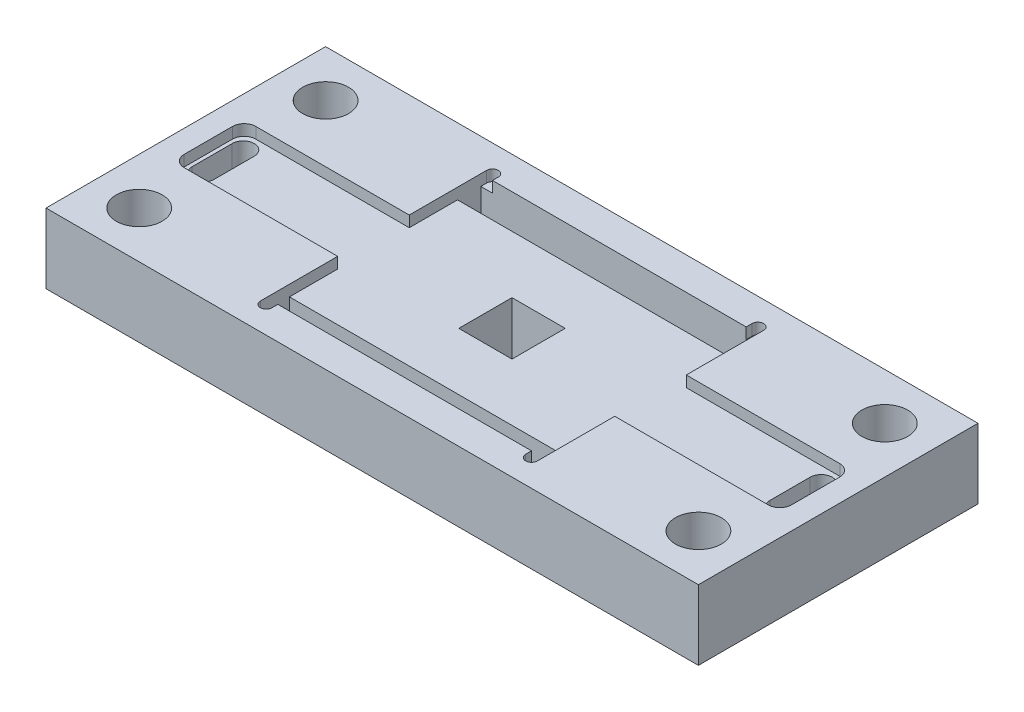
from build123d import *

# Parameters (mm, degrees)
SKETCH1_W           = 177.8
SKETCH1_H           = 76.2
BOSS_EXTRUDE1_DEPTH = 19.05
CUT_EXTRUDE1_DEPTH  = 3
SKETCH3_W           = 14.5
SKETCH3_H           = 14.5
SKETCH3_W_2         = 75.5
SKETCH3_H_2         = 6.35
CUT_EXTRUDE2_DEPTH  = 99.042962522
SKETCH4_R           = 3.5
CUT_EXTRUDE3_DEPTH  = 99.578509321
FILLET1_R           = 3.175
SKETCH5_R           = 6.25
CUT_EXTRUDE4_DEPTH  = 12.7
SKETCH6_W           = 3.175
SKETCH6_H           = 3.18
SKETCH6_W_2         = 3.18
CUT_EXTRUDE5_DEPTH  = 3
FILLET2_R           = 1.5875
FILLET3_R           = 1.59
FILLET4_R           = 1.5875
FILLET5_R           = 1.59
CUT_EXTRUDE6_DEPTH  = 35
CUT_EXTRUDE7_DEPTH  = 35


with BuildPart() as part:
    # Sketch1 → Boss-Extrude1 (new body)
    with BuildSketch(Plane(origin=(0, 0, 0), x_dir=(1, 0, 0), z_dir=(0, 1, 0))):
        Rectangle(SKETCH1_W, SKETCH1_H)
    extrude(amount=-BOSS_EXTRUDE1_DEPTH)

    # Sketch2 → Cut-Extrude1 (cut)
    with BuildSketch(Plane(origin=(0, 0, 0), x_dir=(1, 0, 0), z_dir=(0, 1, 0))):
        Polygon((37.75, 9.75), (82.75, 9.75), (82.75, -9.75), (37.75, -9.75), (37.75, -29.25), (-37.75, -29.25), (-37.75, -9.75), (-82.75, -9.75), (-82.75, 9.75), (-37.75, 9.75), (-37.75, 29.25), (37.75, 29.25), align=None)
    extrude(amount=-CUT_EXTRUDE1_DEPTH, mode=Mode.SUBTRACT)

    # Sketch3 → Cut-Extrude2 (cut, through all)
    with BuildSketch(Plane(origin=(0, -3, 0), x_dir=(1, 0, 0), z_dir=(0, 1, 0))):
        Rectangle(SKETCH3_W, SKETCH3_H)
        with Locations((0, 26.075)):
            Rectangle(SKETCH3_W_2, SKETCH3_H_2)
        with Locations((0, -26.075)):
            Rectangle(SKETCH3_W_2, SKETCH3_H_2)
    extrude(amount=-CUT_EXTRUDE2_DEPTH, mode=Mode.SUBTRACT)

    # Sketch4 → Cut-Extrude3 (cut, through all)
    with BuildSketch(Plane(origin=(0, 0, 0), x_dir=(1, 0, 0), z_dir=(0, 1, 0))):
        with Locations(Location((-76.2, 25.4, 0), (0, 0, 270))):
            Circle(SKETCH4_R)
        with Locations(Location((76.2, 25.4, 0), (0, 0, 270))):
            Circle(SKETCH4_R)
        with Locations(Location((76.2, -25.4, 0), (0, 0, 270))):
            Circle(SKETCH4_R)
        with Locations(Location((-76.2, -25.4, 0), (0, 0, 270))):
            Circle(SKETCH4_R)
    extrude(amount=-CUT_EXTRUDE3_DEPTH, mode=Mode.SUBTRACT)

    # Fillet1
    fillet1_edges = [part.edges().sort_by_distance(p)[0] for p in [
        (82.75, -1.5, -9.75),
        (82.75, -1.5, 9.75),
        (-82.75, -1.5, 9.75),
        (-82.75, -1.5, -9.75),
    ]]
    fillet(fillet1_edges, radius=FILLET1_R)

    # Sketch5 → Cut-Extrude4 (cut)
    with BuildSketch(Plane(origin=(0, 0, 0), x_dir=(1, 0, 0), z_dir=(0, 1, 0))):
        with Locations(Location((-76.2, -25.4, 0), (0, 0, 270))):
            Circle(SKETCH5_R)
        with Locations(Location((-76.2, 25.4, 0), (0, 0, 270))):
            Circle(SKETCH5_R)
        with Locations(Location((76.2, 25.4, 0), (0, 0, 270))):
            Circle(SKETCH5_R)
        with Locations(Location((76.2, -25.4, 0), (0, 0, 270))):
            Circle(SKETCH5_R)
    extrude(amount=-CUT_EXTRUDE4_DEPTH, mode=Mode.SUBTRACT)

    # Sketch6 → Cut-Extrude5 (cut)
    with BuildSketch(Plane(origin=(0, 0, 0), x_dir=(1, 0, 0), z_dir=(0, 1, 0))):
        with Locations((-36.1625, 30.84)):
            Rectangle(SKETCH6_W, SKETCH6_H)
        with Locations((36.16, 30.84)):
            Rectangle(SKETCH6_W_2, SKETCH6_H)
        with Locations((36.16, -30.84)):
            Rectangle(SKETCH6_W_2, SKETCH6_H)
        with Locations((-36.1625, -30.84)):
            Rectangle(SKETCH6_W, SKETCH6_H)
    extrude(amount=-CUT_EXTRUDE5_DEPTH, mode=Mode.SUBTRACT)

    # Fillet2
    fillet2_edges = [part.edges().sort_by_distance(p)[0] for p in [
        (-37.75, -1.5, -32.43),
        (-34.575, -1.5, -32.43),
    ]]
    fillet(fillet2_edges, radius=FILLET2_R - 0.0001)  # a hair under: the kernel refuses the full size

    # Fillet3
    fillet3_edges = [part.edges().sort_by_distance(p)[0] for p in [
        (37.75, -1.5, -32.43),
        (34.57, -1.5, -32.43),
    ]]
    fillet(fillet3_edges, radius=FILLET3_R - 0.0001)  # a hair under: the kernel refuses the full size

    # Fillet4
    fillet4_edges = [part.edges().sort_by_distance(p)[0] for p in [
        (-37.75, -1.5, 32.43),
        (-34.575, -1.5, 32.43),
    ]]
    fillet(fillet4_edges, radius=FILLET4_R - 0.0001)  # a hair under: the kernel refuses the full size

    # Fillet5
    fillet5_edges = [part.edges().sort_by_distance(p)[0] for p in [
        (37.75, -1.5, 32.43),
        (34.57, -1.5, 32.43),
    ]]
    fillet(fillet5_edges, radius=FILLET5_R - 0.0001)  # a hair under: the kernel refuses the full size

    # Sketch8 → Cut-Extrude6 (cut)
    with BuildSketch(Plane(origin=(0, -3, 0), x_dir=(1, 0, 0), z_dir=(0, 1, 0))):
        with BuildLine():
            Line((-75.75, 5.5), (-75.75, -5.5))
            ThreePointArc((-75.75, -5.5), (-78.75, -8.5), (-81.75, -5.5))
            Line((-81.75, -5.5), (-81.75, 5.5))
            ThreePointArc((-81.75, 5.5), (-78.75, 8.5), (-75.75, 5.5))
        make_face()
    extrude(amount=-CUT_EXTRUDE6_DEPTH, mode=Mode.SUBTRACT)

    # Sketch9 → Cut-Extrude7 (cut)
    with BuildSketch(Plane(origin=(0, -3, 0), x_dir=(1, 0, 0), z_dir=(0, 1, 0))):
        with BuildLine():
            Line((81.75, 5.5), (81.75, -5.5))
            ThreePointArc((81.75, -5.5), (78.75, -8.5), (75.75, -5.5))
            Line((75.75, -5.5), (75.75, 5.5))
            ThreePointArc((75.75, 5.5), (78.75, 8.5), (81.75, 5.5))
        make_face()
    extrude(amount=-CUT_EXTRUDE7_DEPTH, mode=Mode.SUBTRACT)


solid = part.part
